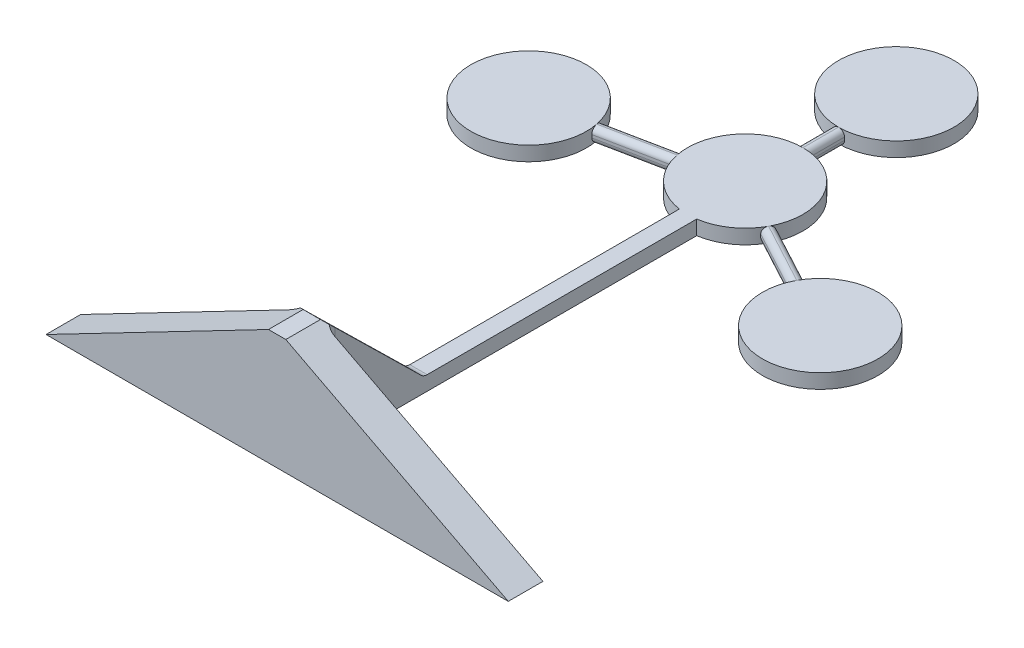
from build123d import *

# Parameters (mm, degrees)
BOSS_EXTRUDE1_DEPTH = 5
BOSS_EXTRUDE2_DEPTH = 3
SKETCH3_W           = 160
SKETCH3_H           = 12
BOSS_EXTRUDE3_DEPTH = 35
FILLET5_R           = 3
CUT_EXTRUDE1_DEPTH  = 241.425192154
FILLET12_R          = 5
FILLET13_R          = 2
FILLET14_R          = 2
FILLET15_R          = 2


# Some blends are built 0.0001 mm under size
with BuildPart() as part:
    # Sketch1 → Boss-Extrude1 (new body)
    with BuildSketch(Plane(origin=(0, 0, 0), x_dir=(1, 0, 0), z_dir=(0, 1, 0))):
        with BuildLine():
            Line((-80, -162), (80, -162))
            Line((80, -162), (80, -150))
            Line((80, -150), (3, -150))
            Line((3, -150), (3, -19.773719933))
            ThreePointArc((3, -19.773719933), (10.684156309, -16.90706373), (16.571665535, -11.197316705))
            Line((16.571665535, -11.197316705), (37.844608185, -22.65513623))
            ThreePointArc((37.844608185, -22.65513623), (73.921408989, -39.814809694), (39.741412764, -19.133470092))
            Line((39.741412764, -19.133470092), (18.468470115, -7.675650567))
            ThreePointArc((18.468470115, -7.675650567), (17.170912293, 10.25474383), (2, 19.899748742))
            Line((2, 19.899748742), (2, 32.406243273))
            ThreePointArc((2, 32.406243273), (0, 72.305992015), (-2, 32.406243273))
            Line((-2, 32.406243273), (-2, 19.899748742))
            ThreePointArc((-2, 19.899748742), (-15.477380683, 12.666913088), (-19.902285109, -1.97460058))
            Line((-19.902285109, -1.97460058), (-43.255678368, -6.68568275))
            ThreePointArc((-43.255678368, -6.68568275), (-81.972040815, -16.536227331), (-42.464692112, -10.606695469))
            Line((-42.464692112, -10.606695469), (-19.111298852, -5.895613299))
            ThreePointArc((-19.111298852, -5.895613299), (-13.052886469, -15.153288581), (-3, -19.773719933))
            Line((-3, -19.773719933), (-3, -150))
            Line((-3, -150), (-80, -150))
            Line((-80, -150), (-80, -162))
        make_face()
    extrude(amount=BOSS_EXTRUDE1_DEPTH)

    # Sketch2 → Boss-Extrude2 (add, symmetric)
    with BuildSketch(Plane(origin=(0, 0, 0), x_dir=(0, 0, -1), z_dir=(1, 0, 0))):
        Polygon((-150, 5), (-150, 40), (-114.292857857, 5), align=None)
    extrude(amount=BOSS_EXTRUDE2_DEPTH, both=True)

    # Sketch3 → Boss-Extrude3 (add)
    with BuildSketch(Plane(origin=(0, 5, 0), x_dir=(1, 0, 0), z_dir=(0, 1, 0))):
        with Locations((0, -156)):
            Rectangle(SKETCH3_W, SKETCH3_H)
    extrude(amount=BOSS_EXTRUDE3_DEPTH)

    # Fillet5
    fillet5_edges = [part.edges().sort_by_distance(p)[0] for p in [
        (0, 5, 114.292857857),
    ]]
    fillet(fillet5_edges, radius=FILLET5_R)

    # Sketch4 → Cut-Extrude1 (cut, through all)
    with BuildSketch(Plane(origin=(0, 0, 150), x_dir=(-1, 0, 0), z_dir=(0, 0, -1))):
        Polygon((80, 0), (3, 40), (80, 40), align=None)
        Polygon((-80, 40), (-80, 0), (-3, 40), align=None)
    extrude(amount=-CUT_EXTRUDE1_DEPTH, mode=Mode.SUBTRACT)

    # Fillet12
    # the kernel refuses this fillet: 5 mm, written as the material it adds along each edge
    with BuildSketch(Plane(origin=(-3, 0, 150), x_dir=(0, 0, -1), z_dir=(0, 1, 0))) as fillet12_piece_1_section:
        with BuildLine():
            CenterArc((FILLET12_R, FILLET12_R), FILLET12_R, 180, 90)
            Line((0, FILLET12_R), (0, 0))
            Line((0, 0), (FILLET12_R, 0))
        make_face()
    fillet12_piece_1 = extrude(amount=52.5, mode=Mode.PRIVATE)
    fillet12_piece_1 = split(fillet12_piece_1, bisect_by=Plane(origin=(-4.134914786, 29.296214811, 139.07995488), z_dir=(0, -0.7141428428542851, 0.7)), keep=Keep.TOP, mode=Mode.PRIVATE)
    fillet12_piece_1 = split(fillet12_piece_1, bisect_by=Plane(origin=(-12.366288086, 35.1343958, 148.888985243), z_dir=(0.4609898282276015, -0.8874054193381323, 0)), keep=Keep.TOP, mode=Mode.PRIVATE)
    add(fillet12_piece_1)
    with BuildSketch(Plane(origin=(3, 0, 150), x_dir=(0, 0, -1), z_dir=(0, 1, 0))) as fillet12_piece_2_section:
        with BuildLine():
            CenterArc((FILLET12_R, -FILLET12_R), FILLET12_R, 90, 90)
            Line((0, -FILLET12_R), (0, 0))
            Line((0, 0), (FILLET12_R, 0))
        make_face()
    fillet12_piece_2 = extrude(amount=52.5, mode=Mode.PRIVATE)
    fillet12_piece_2 = split(fillet12_piece_2, bisect_by=Plane(origin=(4.134914786, 29.296214811, 139.07995488), z_dir=(0, -0.7141428428542851, 0.7)), keep=Keep.TOP, mode=Mode.PRIVATE)
    fillet12_piece_2 = split(fillet12_piece_2, bisect_by=Plane(origin=(12.366288086, 35.1343958, 148.888985243), z_dir=(-0.4609898282276015, -0.8874054193381323, 0)), keep=Keep.TOP, mode=Mode.PRIVATE)
    add(fillet12_piece_2)

    # Fillet13
    fillet13_edges = [part.edges().sort_by_distance(p)[0] for p in [
        (-30.787995482, 0, 8.251154384),
        (-31.578981738, 0, 4.330141665),
        (-31.578981738, 5, 4.330141665),
        (-30.787995482, 5, 8.251154384),
    ]]
    fillet(fillet13_edges, radius=FILLET13_R - 0.0001)  # a hair under: the kernel refuses the full size

    # Fillet14
    fillet14_edges = [part.edges().sort_by_distance(p)[0] for p in [
        (27.20813686, 5, 16.926226468),
        (29.104941439, 5, 13.40456033),
        (29.104941439, 0, 13.40456033),
        (27.20813686, 0, 16.926226468),
    ]]
    fillet(fillet14_edges, radius=FILLET14_R - 0.0001)  # a hair under: the kernel refuses the full size

    # Fillet15
    fillet15_edges = [part.edges().sort_by_distance(p)[0] for p in [
        (-2, 0, -26.152996008),
        (2, 0, -26.152996008),
        (2, 5, -26.152996008),
        (-2, 5, -26.152996008),
    ]]
    fillet(fillet15_edges, radius=FILLET15_R - 0.0001)  # a hair under: the kernel refuses the full size


solid = part.part
